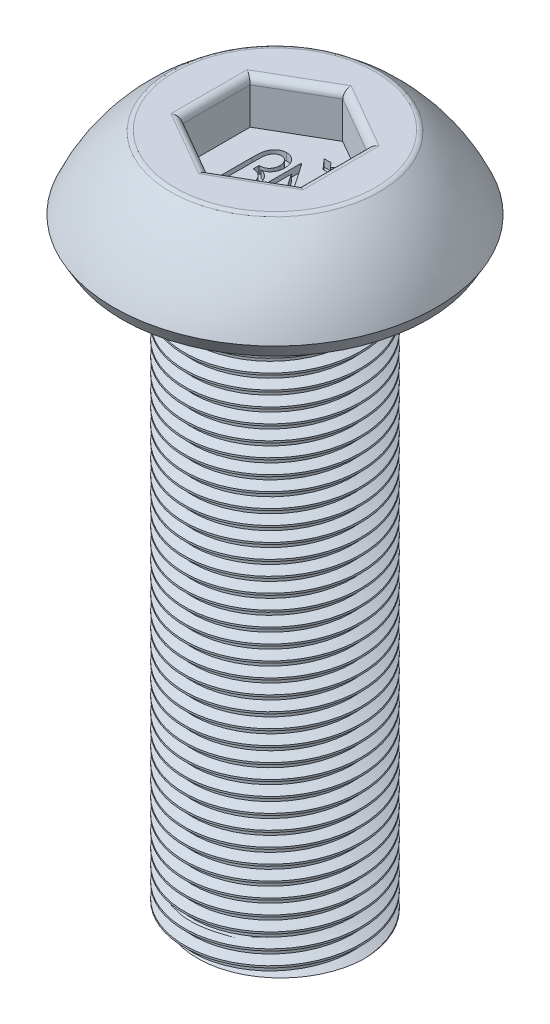
from build123d import *

# Parameters (mm, degrees)
CUT_EXTRUDE1_DEPTH = 0.75
FILLET1_R          = 0.125
WRAP1_START        = -0.125
WRAP1_DEPTH        = 0.125
THREAD1_PITCH      = 0.25


# Read off the part's stored shape, not the designer's step: Wrap1
with BuildPart() as part:
    # Sketch1 → Revolve1 (revolve)
    with BuildSketch(Plane(origin=(0, 0, 0), x_dir=(0, 0, -1), z_dir=(1, 0, 0)), mode=Mode.PRIVATE) as revolve1_sk:
        with BuildLine():
            Line((0, 1.5), (-1.75, 1.5))
            ThreePointArc((-1.75, 1.5), (-2.334912942, 0.942930354), (-2.75, 0.25))
            Line((-2.75, 0.25), (-2.605662433, 0))
            Line((-2.605662433, 0), (-1.5, 0))
            Line((-1.5, 0), (-1.5, -10))
            Line((-1.5, -10), (0, -10))
            Line((0, -10), (0, 1.5))
        make_face()
    revolve(revolve1_sk.sketch.rotate(Axis((0, -10, 0), (0, 1, 0)), 180), axis=Axis((0, -10, 0), (0, 1, 0)))

    # Sketch2 → Cut-Extrude1 (cut)
    with BuildSketch(Plane(origin=(0, 1.5, 0), x_dir=(1, 0, 0), z_dir=(0, 1, 0))):
        Polygon((0, 1.154700538), (-1, 0.577350269), (-1, -0.577350269), (0, -1.154700538), (1, -0.577350269), (1, 0.577350269), align=None)
    extrude(amount=-CUT_EXTRUDE1_DEPTH, mode=Mode.SUBTRACT)

    # Fillet1
    fillet1_edges = [part.edges().sort_by_distance(p)[0] for p in [
        (0.5, 1.5, -0.866025404),
        (-0.5, 1.5, -0.866025404),
        (-1, 1.5, 0),
        (-0.5, 1.5, 0.866025404),
        (0.5, 1.5, 0.866025404),
        (1, 1.5, 0),
        (0, 1.5, 1.75),
    ]]
    fillet(fillet1_edges, radius=FILLET1_R)

    # Wrap1 outline → Wrap1 (cut)
    with BuildSketch(Plane(origin=(0, 0.75, 0), x_dir=(1, 0, 0), z_dir=(0, 1, 0)).offset(WRAP1_START)):
        with BuildLine():
            add(Edge.make_bspline(
                [(-0.537455829, 0.145072229), (-0.537366548, 0.15735919), (-0.537194747, 0.181002472), (-0.536236546, 0.215136123), (-0.534510696, 0.246473554), (-0.531857696, 0.275057496), (-0.528751002, 0.300937263), (-0.524861231, 0.324098842), (-0.520025531, 0.344486675), (-0.512963856, 0.367808475), (-0.501673714, 0.39403328), (-0.484042302, 0.422215735), (-0.462961845, 0.447719467), (-0.43819726, 0.469796385), (-0.410438674, 0.48826361), (-0.379753396, 0.501330341), (-0.346770262, 0.509472114), (-0.323962243, 0.510388658), (-0.312295573, 0.510857485)],
                knots=[0, 0, 0, 0, 0.075666503, 0.145601872, 0.210267314, 0.268902852, 0.322354979, 0.370758742, 0.413447068, 0.451298193, 0.520734923, 0.588514213, 0.655379256, 0.723813985, 0.792131248, 0.85973193, 0.928250616, 1, 1, 1, 1], degree=3))
            Line((-0.537455829, 0.145072229), (-0.537455829, -0.527604053))
            Line((-0.537455829, -0.527604053), (-0.460532752, -0.527604053))
            Line((-0.460532752, -0.527604053), (-0.460532752, 0.137460049))
            add(Edge.make_bspline(
                [(-0.447712239, 0.305328639), (-0.448774545, 0.301469619), (-0.451134212, 0.292897693), (-0.453525545, 0.278533298), (-0.455753975, 0.261566558), (-0.457491806, 0.241915402), (-0.458861613, 0.219538201), (-0.459832928, 0.194491685), (-0.460431178, 0.166843342), (-0.460497896, 0.147543183), (-0.460532752, 0.137460049)],
                knots=[0, 0, 0, 0, 0.071102967, 0.157938928, 0.258486703, 0.375288845, 0.508476997, 0.656953648, 0.820779591, 1, 1, 1, 1], degree=3))
            add(Edge.make_bspline(
                [(-0.310292367, 0.421113895), (-0.317674297, 0.420714803), (-0.332400851, 0.419918636), (-0.353965955, 0.413875353), (-0.374511474, 0.403804365), (-0.393760239, 0.390026559), (-0.411220155, 0.372905819), (-0.426330799, 0.352966004), (-0.438683838, 0.330213781), (-0.444651659, 0.313764569), (-0.447712239, 0.305328639)],
                knots=[0, 0, 0, 0, 0.115143072, 0.229704239, 0.346728965, 0.47082069, 0.597615275, 0.727089869, 0.860038825, 1, 1, 1, 1], degree=3))
            add(Edge.make_bspline(
                [(-0.17848147, 0.261057806), (-0.178952566, 0.271974178), (-0.179864172, 0.293098195), (-0.186637459, 0.323530756), (-0.198777604, 0.350930356), (-0.212261145, 0.371485038), (-0.225066026, 0.38586534), (-0.235235588, 0.395399384), (-0.246252738, 0.403200746), (-0.257654824, 0.410013084), (-0.269995595, 0.414921405), (-0.282862679, 0.418632696), (-0.296413152, 0.420560449), (-0.305613195, 0.420927309), (-0.310292367, 0.421113895)],
                knots=[0, 0, 0, 0, 0.141583044, 0.273974039, 0.401600231, 0.528456794, 0.591043942, 0.651122908, 0.708825408, 0.765880537, 0.822988251, 0.880580103, 0.939262648, 1, 1, 1, 1], degree=3))
            add(Edge.make_bspline(
                [(-0.340941406, 0.087780562), (-0.334988303, 0.08792105), (-0.323299062, 0.088196907), (-0.306225523, 0.090764835), (-0.289888322, 0.094368098), (-0.274654087, 0.100137271), (-0.260174408, 0.107124777), (-0.24682212, 0.11601785), (-0.234254323, 0.126336142), (-0.222711003, 0.138095802), (-0.212416341, 0.151054166), (-0.203323514, 0.164708223), (-0.195692258, 0.179095557), (-0.189162431, 0.194099224), (-0.184457799, 0.209936522), (-0.181072867, 0.226359939), (-0.178698712, 0.243427453), (-0.178554801, 0.255106579), (-0.17848147, 0.261057806)],
                knots=[0, 0, 0, 0, 0.067065692, 0.131687113, 0.194317921, 0.255289037, 0.314878218, 0.375218702, 0.435653028, 0.497934511, 0.56059698, 0.621980302, 0.682601877, 0.743985199, 0.806139168, 0.868443394, 0.932963888, 1, 1, 1, 1], degree=3))
            Line((-0.340941406, 0.087780562), (-0.357968649, 0.087780562))
            Line((-0.357968649, 0.087780562), (-0.357968649, -0.014783541))
            add(Edge.make_bspline(
                [(-0.152840444, -0.246153733), (-0.152991921, -0.237935238), (-0.153288163, -0.221862292), (-0.155672785, -0.198335348), (-0.159894598, -0.176034257), (-0.165736265, -0.154867378), (-0.173053307, -0.13483662), (-0.182215246, -0.116043494), (-0.192787882, -0.098300128), (-0.20519576, -0.081953022), (-0.21910276, -0.067000398), (-0.234429011, -0.053697294), (-0.25160782, -0.04265632), (-0.269991613, -0.033131715), (-0.29004854, -0.025867397), (-0.311286964, -0.019869429), (-0.334167811, -0.016416131), (-0.349879854, -0.015338382), (-0.357968649, -0.014783541)],
                knots=[0, 0, 0, 0, 0.070899124, 0.138657723, 0.203740428, 0.266496883, 0.327925022, 0.387445969, 0.44662859, 0.505853257, 0.564143059, 0.622569358, 0.680413321, 0.739931479, 0.800819634, 0.864131594, 0.930052902, 1, 1, 1, 1], degree=3))
            add(Edge.make_bspline(
                [(-0.309891726, -0.450680977), (-0.304334961, -0.450571211), (-0.293413044, -0.450355466), (-0.277514036, -0.447340483), (-0.262286727, -0.442989313), (-0.247781817, -0.436676481), (-0.233907442, -0.428733085), (-0.221051475, -0.418678171), (-0.208664071, -0.407189838), (-0.197187775, -0.393882067), (-0.186871623, -0.37903336), (-0.17755536, -0.363253667), (-0.169907305, -0.346235338), (-0.163848892, -0.328206631), (-0.158625475, -0.30926113), (-0.155449196, -0.289102842), (-0.15305503, -0.26797937), (-0.152912733, -0.253506267), (-0.152840444, -0.246153733)],
                knots=[0, 0, 0, 0, 0.057830355, 0.113666545, 0.168061557, 0.222616608, 0.278122197, 0.334218011, 0.392319921, 0.453992458, 0.516935927, 0.58055674, 0.644719566, 0.710965936, 0.778658745, 0.849251577, 0.923417744, 1, 1, 1, 1], degree=3))
            add(Edge.make_bspline(
                [(-0.409250701, -0.417427771), (-0.40035509, -0.422552084), (-0.383473121, -0.432276934), (-0.357561529, -0.44229785), (-0.333383308, -0.449497533), (-0.317482442, -0.450298576), (-0.309891726, -0.450680977)],
                knots=[0, 0, 0, 0, 0.290177362, 0.550694617, 0.785511707, 1, 1, 1, 1], degree=3))
            Line((-0.409250701, -0.417427771), (-0.409250701, -0.507371682))
            add(Edge.make_bspline(
                [(-0.298273137, -0.540424566), (-0.308861639, -0.540097242), (-0.329301798, -0.539465371), (-0.358664913, -0.532954409), (-0.385682425, -0.522833546), (-0.401463988, -0.512480121), (-0.409250701, -0.507371682)],
                knots=[0, 0, 0, 0, 0.269471748, 0.52019112, 0.763259579, 1, 1, 1, 1], degree=3))
            add(Edge.make_bspline(
                [(-0.075917367, -0.249759502), (-0.076128163, -0.26018073), (-0.076541077, -0.280594276), (-0.079227651, -0.310491914), (-0.084396107, -0.33890103), (-0.091033777, -0.365960134), (-0.09992887, -0.391457717), (-0.110563094, -0.41559927), (-0.123397597, -0.438155636), (-0.137962217, -0.459132621), (-0.153934421, -0.478163377), (-0.171095941, -0.494958486), (-0.189740067, -0.508821331), (-0.209271063, -0.520337979), (-0.2298646, -0.529505832), (-0.251686582, -0.535889962), (-0.274626983, -0.539804561), (-0.290311376, -0.540215808), (-0.298273137, -0.540424566)],
                knots=[0, 0, 0, 0, 0.076485505, 0.149823073, 0.219996399, 0.288217649, 0.354082023, 0.417919027, 0.481558234, 0.544225908, 0.605087621, 0.663657146, 0.720011753, 0.77514507, 0.829777395, 0.884976008, 0.941611157, 1, 1, 1, 1], degree=3))
            add(Edge.make_bspline(
                [(-0.194707432, 0.00885428), (-0.185532098, 0.002246917), (-0.167142487, -0.010995852), (-0.14356067, -0.035865532), (-0.123015599, -0.064046821), (-0.106173919, -0.095826321), (-0.092429948, -0.130510752), (-0.082995533, -0.168026939), (-0.077008082, -0.208034101), (-0.076287996, -0.23558107), (-0.075917367, -0.249759502)],
                knots=[0, 0, 0, 0, 0.114174048, 0.228832702, 0.344903554, 0.466103946, 0.591676048, 0.72144281, 0.856626542, 1, 1, 1, 1], degree=3))
            add(Edge.make_bspline(
                [(-0.273032752, 0.036899152), (-0.264977593, 0.035253476), (-0.249714467, 0.032135208), (-0.228666305, 0.025295577), (-0.210172583, 0.018341569), (-0.199638474, 0.011879289), (-0.194707432, 0.00885428)],
                knots=[0, 0, 0, 0, 0.294434237, 0.557901696, 0.79305271, 1, 1, 1, 1], degree=3))
            add(Edge.make_bspline(
                [(-0.200917367, 0.061939216), (-0.205600715, 0.059219735), (-0.215469689, 0.053489114), (-0.232413767, 0.046806913), (-0.251771921, 0.040993346), (-0.265723651, 0.038306664), (-0.273032752, 0.036899152)],
                knots=[0, 0, 0, 0, 0.211315364, 0.445293882, 0.709397831, 1, 1, 1, 1], degree=3))
            add(Edge.make_bspline(
                [(-0.101558393, 0.265064216), (-0.101829728, 0.254158186), (-0.102360461, 0.23282596), (-0.107582885, 0.201794643), (-0.115635878, 0.172523389), (-0.127393107, 0.145424978), (-0.141807851, 0.120566799), (-0.158666737, 0.09801557), (-0.178511599, 0.078390972), (-0.193428545, 0.067437991), (-0.200917367, 0.061939216)],
                knots=[0, 0, 0, 0, 0.138734507, 0.271365083, 0.399463796, 0.524371928, 0.64626696, 0.764603187, 0.881822663, 1, 1, 1, 1], degree=3))
            add(Edge.make_bspline(
                [(-0.312295573, 0.510857485), (-0.304601721, 0.510709635), (-0.289468193, 0.510418818), (-0.267407867, 0.506806308), (-0.246411552, 0.501505665), (-0.226632783, 0.49383833), (-0.208041676, 0.483900131), (-0.190537128, 0.47184286), (-0.174217748, 0.457507541), (-0.159329374, 0.44106616), (-0.145724285, 0.423136003), (-0.133914037, 0.403846519), (-0.123827558, 0.383480477), (-0.115525112, 0.361982783), (-0.109489008, 0.339238969), (-0.104721569, 0.315513437), (-0.102229905, 0.290624502), (-0.101784813, 0.273682609), (-0.101558393, 0.265064216)],
                knots=[0, 0, 0, 0, 0.063537388, 0.124975739, 0.184284437, 0.242302503, 0.299838056, 0.35817297, 0.417627897, 0.478966986, 0.541230446, 0.60342781, 0.66563497, 0.728883988, 0.793562004, 0.859921094, 0.928741429, 1, 1, 1, 1], degree=3))
        make_face()
        Polygon((0.565629107, -0.527604053), (0.583056992, -0.527604053), (0.583056992, 0.472395947), (0.506133915, 0.472395947), (0.506133915, -0.290224246), (-0.016101662, 0.472395947), (-0.032327624, 0.472395947), (-0.032327624, -0.527604053), (0.044595453, -0.527604053), (0.044595453, 0.233012934), align=None)
        Polygon((0.095877504, 0.741626716), (0.244315004, 0.574960049), (0.318633915, 0.574960049), (0.467672376, 0.741626716), (0.350885517, 0.741626716), (0.280172376, 0.662700434), (0.212664363, 0.741626716), align=None)
    extrude(amount=WRAP1_DEPTH, mode=Mode.SUBTRACT)

    # Thread1: the profile of Thread Profile1 profile screwed along a right-hand helix of 43 turns, 6 arcs to a turn; built about Z, then put on its axis
    thread1_z = Axis((0, 0, 0), (0, 0, 1))
    thread1_corners = [(1.5003, 0, -0.000173205), (1.5003, 0, 0.218923204), (1.364683531, 0, 0.140625), (1.364683531, 0, 0.078125)]
    with BuildLine(mode=Mode.PRIVATE) as thread1_profile:
        Line(thread1_corners[0], thread1_corners[1])
        Line(thread1_corners[1], thread1_corners[2])
        Line(thread1_corners[2], thread1_corners[3])
        Line(thread1_corners[3], thread1_corners[0])
    thread1_cap = Face(thread1_profile.wire())
    thread1_turn_angles = [0, 30, 60, 90, 120, 150, 180, 210, 240, 270, 300, 330, 360, 390, 420, 450, 480, 510, 540, 570, 600, 630, 660, 690, 720]
    thread1_turn_weights = [1, 0.8660254037844387, 1, 0.8660254037844387, 1, 0.8660254037844387, 1, 0.8660254037844387, 1, 0.8660254037844387, 1, 0.8660254037844387, 1, 0.8660254037844387, 1, 0.8660254037844387, 1, 0.8660254037844387, 1, 0.8660254037844387, 1, 0.8660254037844387, 1, 0.8660254037844387, 1]
    thread1_turn_rails = [Edge.make_bspline([Vector(p[0], p[1], 0).rotate(thread1_z, thread1_turn_angles[k]) / thread1_turn_weights[k] + Vector(0, 0, p[2] + THREAD1_PITCH * thread1_turn_angles[k] / 360) for k in range(25)], [0, 0, 0, 1, 1, 2, 2, 3, 3, 4, 4, 5, 5, 6, 6, 7, 7, 8, 8, 9, 9, 10, 10, 11, 11, 12, 12, 12], 2, thread1_turn_weights) for p in thread1_corners]
    thread1_turn_sides = [Face.make_surface_from_curves(thread1_turn_rails[p[0]], thread1_turn_rails[p[1]]) for p in [(0, 1), (1, 2), (2, 3), (3, 0)]]
    thread1_last_angles = [15120, 15150, 15180, 15210, 15240, 15270, 15300, 15330, 15360, 15390, 15420, 15450, 15480]
    thread1_last_weights = [1, 0.8660254037844387, 1, 0.8660254037844387, 1, 0.8660254037844387, 1, 0.8660254037844387, 1, 0.8660254037844387, 1, 0.8660254037844387, 1]
    thread1_last_rails = [Edge.make_bspline([Vector(p[0], p[1], 0).rotate(thread1_z, thread1_last_angles[k]) / thread1_last_weights[k] + Vector(0, 0, p[2] + THREAD1_PITCH * thread1_last_angles[k] / 360) for k in range(13)], [0, 0, 0, 1, 1, 2, 2, 3, 3, 4, 4, 5, 5, 6, 6, 6], 2, thread1_last_weights) for p in thread1_corners]
    thread1_last_sides = [Face.make_surface_from_curves(thread1_last_rails[p[0]], thread1_last_rails[p[1]]) for p in [(0, 1), (1, 2), (2, 3), (3, 0)]]
    thread1 = Plane(origin=(0, -11, 0), x_dir=(1, 0, 0), z_dir=(0, 1, 0)) * Solid(Shell([*[p.moved(Location((0, 0, 2 * THREAD1_PITCH * i))) for i in range(21) for p in thread1_turn_sides], *thread1_last_sides, thread1_cap, thread1_cap.rotate(thread1_z, 15480).moved(Location((0, 0, THREAD1_PITCH * 15480 / 360)))]))
    add(thread1, mode=Mode.SUBTRACT)


solid = part.part
